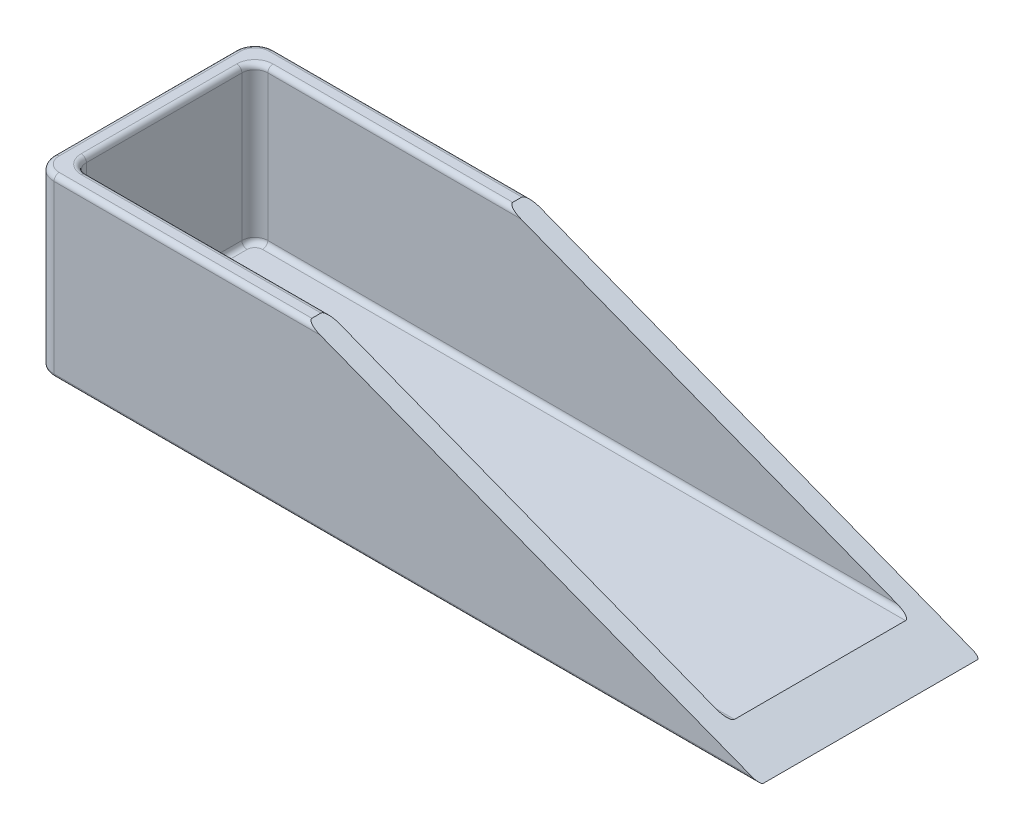
from build123d import *

# Parameters (mm, degrees)
SKETCH1_W           = 244.475
SKETCH1_H           = 53.975
SKETCH1_W_2         = 234.95
SKETCH1_H_2         = 44.45
BOSS_EXTRUDE1_DEPTH = 38.1
SKETCH2_W           = 244.475
SKETCH2_H           = 53.975
BOSS_EXTRUDE2_DEPTH = 4.7625
FILLET1_R           = 3.175
FILLET2_R           = 4.7625
SKETCH4_R           = 12.065
CUT_EXTRUDE2_DEPTH  = 133.316006094
FILLET4_R           = 1.27
FILLET5_R           = 0.762
FILLET6_R           = 1.27
FILLET9_R           = 0.508
CUT_EXTRUDE10_DEPTH = 139.949332693


with BuildPart() as part:
    # Sketch1 → Boss-Extrude1 (new body)
    with BuildSketch(Plane(origin=(0, 0, 0), x_dir=(1, 0, 0), z_dir=(0, 1, 0))):
        Rectangle(SKETCH1_W, SKETCH1_H)
        Rectangle(SKETCH1_W_2, SKETCH1_H_2, mode=Mode.SUBTRACT)
    extrude(amount=BOSS_EXTRUDE1_DEPTH)

    # Sketch2 → Boss-Extrude2 (add)
    with BuildSketch(Plane.XZ):
        Rectangle(SKETCH2_W, SKETCH2_H)
        with BuildLine():
            ThreePointArc((107.575, 4.25), (109.675, 6.35), (107.575, 8.45))
            ThreePointArc((107.575, 8.45), (105.475, 6.35), (107.575, 4.25))
        make_face(mode=Mode.SUBTRACT)
        with BuildLine():
            ThreePointArc((76.575, 4.25), (78.675, 6.35), (76.575, 8.45))
            ThreePointArc((76.575, 8.45), (74.475, 6.35), (76.575, 4.25))
        make_face(mode=Mode.SUBTRACT)
    extrude(amount=BOSS_EXTRUDE2_DEPTH)

    # Fillet1
    fillet1_edges = [part.edges().sort_by_distance(p)[0] for p in [
        (117.475, 19.05, -22.225),
        (117.475, 19.05, 22.225),
        (-117.475, 19.05, 22.225),
        (-117.475, 19.05, -22.225),
    ]]
    fillet(fillet1_edges, radius=FILLET1_R)

    # Fillet2
    fillet2_edges = [part.edges().sort_by_distance(p)[0] for p in [
        (-122.2375, 16.66875, -26.9875),
        (122.2375, 16.66875, -26.9875),
        (122.2375, 16.66875, 26.9875),
        (-122.2375, 16.66875, 26.9875),
    ]]
    fillet(fillet2_edges, radius=FILLET2_R)

    # Sketch4 → Cut-Extrude2 (cut, through all)
    with BuildSketch(Plane.XZ.offset(4.7625)):
        with Locations((90.4875, 4.7625)):
            Circle(SKETCH4_R)
    extrude(amount=-CUT_EXTRUDE2_DEPTH, mode=Mode.SUBTRACT)

    # Fillet4
    fillet4_edges = [part.edges().sort_by_distance(p)[0] for p in [
        (116.54506403, 0, -21.29506403),
        (117.475, 0, 0),
        (116.54506403, 0, 21.29506403),
        (0, 0, 22.225),
        (-116.54506403, 0, 21.29506403),
        (-117.475, 0, 0),
        (-116.54506403, 0, -21.29506403),
        (0, 0, -22.225),
    ]]
    fillet(fillet4_edges, radius=FILLET4_R)

    # Fillet5
    fillet5_edges = [part.edges().sort_by_distance(p)[0] for p in [
        (-120.842596045, -4.7625, 25.592596045),
        (0, -4.7625, 26.9875),
        (120.842596045, -4.7625, 25.592596045),
        (122.2375, -4.7625, 0),
        (120.842596045, -4.7625, -25.592596045),
        (0, -4.7625, -26.9875),
        (-120.842596045, -4.7625, -25.592596045),
        (-122.2375, -4.7625, 0),
    ]]
    fillet(fillet5_edges, radius=FILLET5_R)

    # Fillet6
    fillet6_edges = [part.edges().sort_by_distance(p)[0] for p in [
        (116.54506403, 38.1, -21.29506403),
        (117.475, 38.1, 0),
        (116.54506403, 38.1, 21.29506403),
        (0, 38.1, 22.225),
        (-116.54506403, 38.1, 21.29506403),
        (-117.475, 38.1, 0),
        (-116.54506403, 38.1, -21.29506403),
        (120.842596045, 38.1, -25.592596045),
        (122.2375, 38.1, 0),
        (120.842596045, 38.1, 25.592596045),
        (0, 38.1, 26.9875),
        (-120.842596045, 38.1, 25.592596045),
        (-122.2375, 38.1, 0),
        (-120.842596045, 38.1, -25.592596045),
        (0, 38.1, -22.225),
        (0, 38.1, -26.9875),
    ]]
    fillet(fillet6_edges, radius=FILLET6_R)

    # Fillet9
    fillet9_edges = [part.edges().sort_by_distance(p)[0] for p in [
        (107.575, 0, 8.45),
        (74.488539124, 0, 6.588077746),
        (90.177837069, 0, -7.298525407),
    ]]
    fillet(fillet9_edges, radius=FILLET9_R)

    # Sketch16 → Cut-Extrude10 (cut, through all)
    with BuildSketch(Plane(origin=(0, 0, -26.9875), x_dir=(-1, 0, 0), z_dir=(0, 0, -1))):
        Polygon((55.5625, 38.1), (-122.2375, 38.1), (-122.2375, -4.7625), (-55.5625, -4.7625), align=None)
    extrude(amount=-CUT_EXTRUDE10_DEPTH, mode=Mode.SUBTRACT)


solid = part.part
